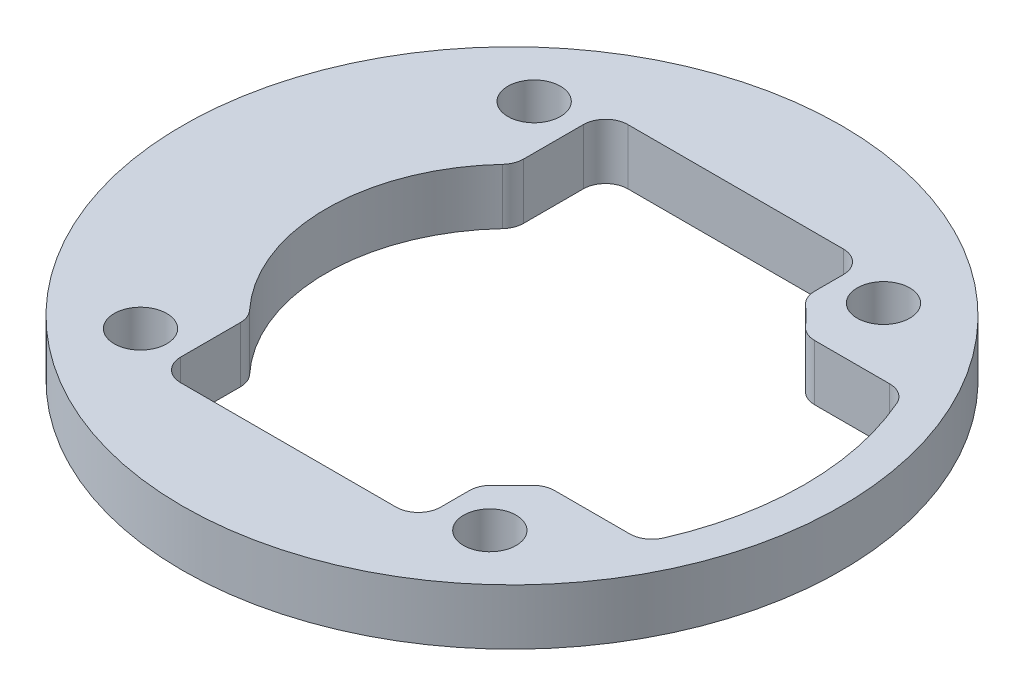
from build123d import *

# Parameters (mm, degrees)
STOCK_DGT_START                               = 23.8125
STOCK_DGT_INSIDE_SWERVE_STRUCTURE_SM_2_R      = 28.175
STOCK_DGT_INSIDE_SWERVE_STRUCTURE_SM_2_R_2    = 2.2479
STOCK_DGT_INSIDE_SWERVE_STRUCTURE_SMALL_DEPTH = 4.7625
FILLET1_R                                     = 1.905


# Read off the part's stored shape, not the designer's step: Stock-DGT inside swerve structure Small Bearing-1
with BuildPart() as part:
    # Stock-DGT inside swerve structure Sm 2 → Stock-DGT inside swerve structure Small Bearing-1 (new body)
    with BuildSketch(Plane(origin=(0, 0, 0), x_dir=(1, 0, 0), z_dir=(0, 1, 0)).offset(STOCK_DGT_START)):
        Circle(STOCK_DGT_INSIDE_SWERVE_STRUCTURE_SM_2_R)
        with Locations((-14.933176064, -16.8275)):
            Circle(STOCK_DGT_INSIDE_SWERVE_STRUCTURE_SM_2_R_2, mode=Mode.SUBTRACT)
        with Locations((14.933176064, -16.8275)):
            Circle(STOCK_DGT_INSIDE_SWERVE_STRUCTURE_SM_2_R_2, mode=Mode.SUBTRACT)
        with Locations((-14.933176064, 16.8275)):
            Circle(STOCK_DGT_INSIDE_SWERVE_STRUCTURE_SM_2_R_2, mode=Mode.SUBTRACT)
        with BuildLine():
            ThreePointArc((11.1125, 13.879508051), (12.572358569, 12.572358569), (13.879508051, 11.1125))
            Line((13.879508051, 11.1125), (22.394471276, 11.1125))
            ThreePointArc((22.394471276, 11.1125), (25, 0), (22.394471276, -11.1125))
            Line((22.394471276, -11.1125), (13.879508051, -11.1125))
            ThreePointArc((13.879508051, -11.1125), (12.572358569, -12.572358569), (11.1125, -13.879508051))
            Line((11.1125, -13.879508051), (11.1125, -19.116031394))
            Line((11.1125, -19.116031394), (-11.1125, -19.116031394))
            Line((-11.1125, -19.116031394), (-11.1125, -11.33701763))
            ThreePointArc((-11.1125, -11.33701763), (-15.875, 0), (-11.1125, 11.33701763))
            Line((-11.1125, 11.33701763), (-11.1125, 19.116031394))
            Line((-11.1125, 19.116031394), (11.1125, 19.116031394))
            Line((11.1125, 19.116031394), (11.1125, 13.879508051))
        make_face(mode=Mode.SUBTRACT)
        with Locations((14.933176064, 16.8275)):
            Circle(STOCK_DGT_INSIDE_SWERVE_STRUCTURE_SM_2_R_2, mode=Mode.SUBTRACT)
    extrude(amount=STOCK_DGT_INSIDE_SWERVE_STRUCTURE_SMALL_DEPTH)

    # Fillet1
    fillet1_edges = [part.edges().sort_by_distance(p)[0] for p in [
        (22.394471276, 26.19375, 11.1125),
        (22.394471276, 26.19375, -11.1125),
        (11.1125, 26.19375, 13.879508051),
        (11.1125, 26.19375, -13.879508051),
        (13.879508051, 26.19375, -11.1125),
        (13.879508051, 26.19375, 11.1125),
        (-11.1125, 26.19375, -11.33701763),
        (-11.1125, 26.19375, 11.33701763),
        (11.1125, 26.19375, -19.116031394),
        (-11.1125, 26.19375, 19.116031394),
        (11.1125, 26.19375, 19.116031394),
        (-11.1125, 26.19375, -19.116031394),
    ]]
    fillet(fillet1_edges, radius=FILLET1_R)


solid = part.part
